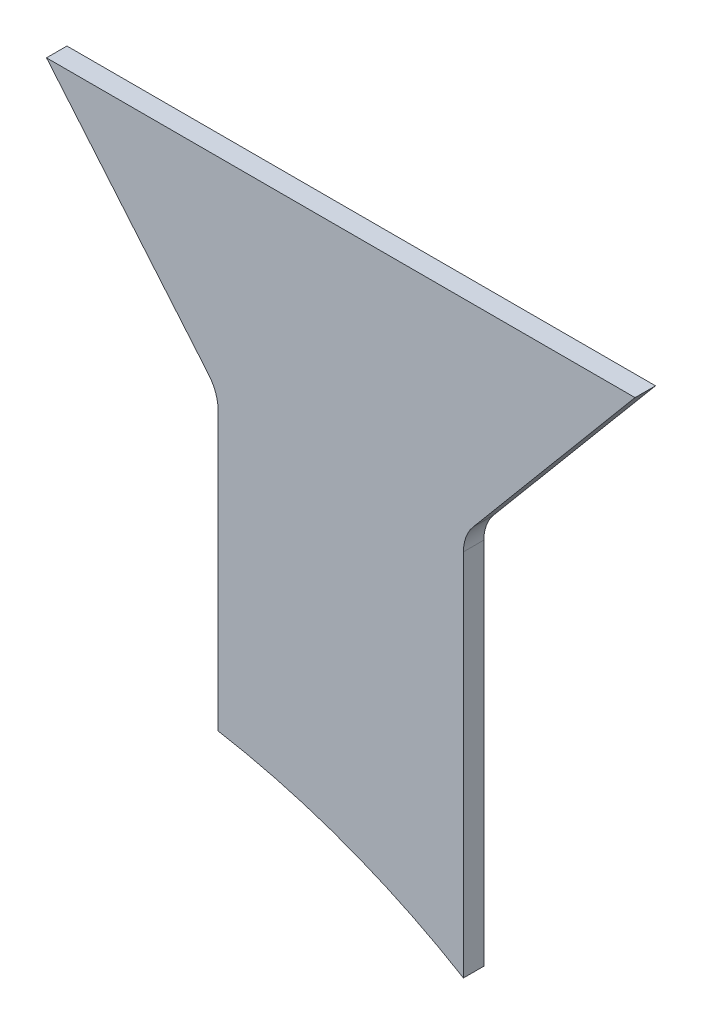
from build123d import *

# Parameters (mm, degrees)
FUNNEL_SIDE_PANEL_DEPTH = 5
FILLET1_R               = 10


with BuildPart() as part:
    # Sketch1 → Funnel - Side Panel (new body)
    with BuildSketch(Plane.XY):
        with BuildLine():
            Line((30, 0), (30, 93.9))
            Line((30, 93.9), (71.974030913, 143.922702136))
            Line((71.974030913, 143.922702136), (-71.974030913, 143.922702136))
            Line((-71.974030913, 143.922702136), (-30, 93.9))
            Line((-30, 93.9), (-30, 22.326086298))
            ThreePointArc((-30, 22.326086298), (1.02961193, 13.930062634), (30, 0))
        make_face()
    extrude(amount=FUNNEL_SIDE_PANEL_DEPTH)

    # Fillet1
    fillet1_edges = [part.edges().sort_by_distance(p)[0] for p in [
        (-30, 93.9, 2.5),
        (30, 93.9, 2.5),
    ]]
    fillet(fillet1_edges, radius=FILLET1_R)


solid = part.part
